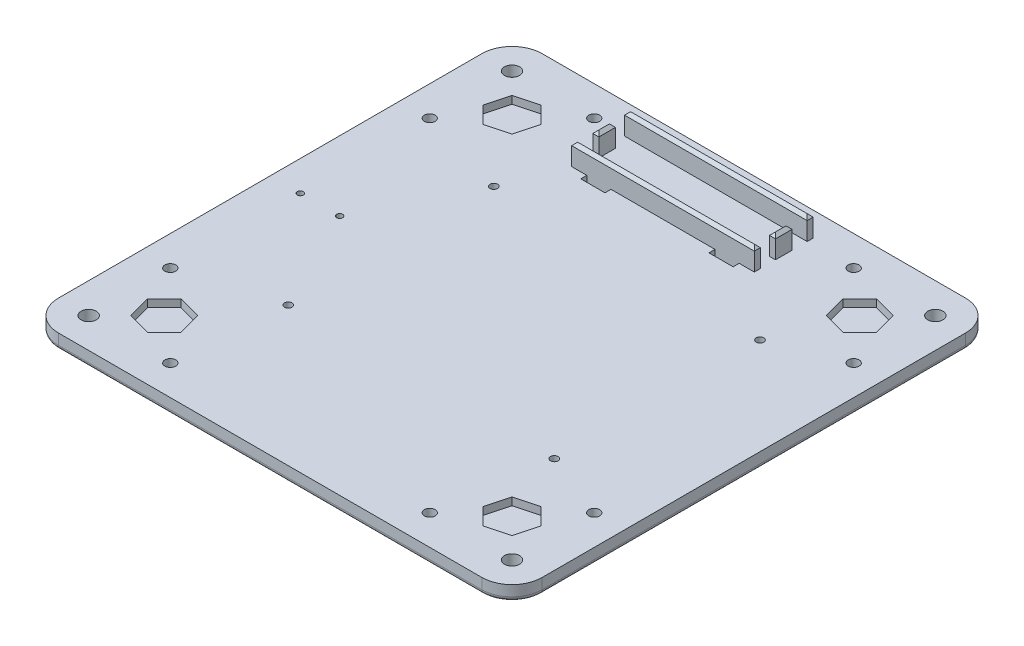
from build123d import *

# Parameters (mm, degrees)
SKETCH1_W           = 203.2
SKETCH1_H           = 203.2
BOSS_EXTRUDE1_DEPTH = 6.35
FILLET1_R           = 12.7
SKETCH2_R           = 3.175
CUT_EXTRUDE1_DEPTH  = 288.438345563
CUT_EXTRUDE2_DEPTH  = 3.175
FILLET2_R           = 1.905
SKETCH28_R          = 2.286
CUT_EXTRUDE3_DEPTH  = 288.438345634
SKETCH30_R          = 1.5875
CUT_EXTRUDE4_DEPTH  = 288.438345634
SKETCH31_R          = 1.27
CUT_EXTRUDE5_DEPTH  = 288.438345634
SKETCH32_W          = 2.54
SKETCH32_H          = 6.9596
BOSS_EXTRUDE3_DEPTH = 8.89
CHAMFER2_SIZE       = 1.27
SKETCH33_W          = 10.16
SKETCH33_H          = 2.54
CUT_EXTRUDE6_DEPTH  = 288.505673232


with BuildPart() as part:
    # Sketch1 → Boss-Extrude1 (new body)
    with BuildSketch(Plane(origin=(0, 0, 0), x_dir=(1, 0, 0), z_dir=(0, 1, 0))):
        with Locations((101.6, 101.6)):
            Rectangle(SKETCH1_W, SKETCH1_H)
    extrude(amount=BOSS_EXTRUDE1_DEPTH)

    # Fillet1
    fillet1_edges = [part.edges().sort_by_distance(p)[0] for p in [
        (0, 3.175, -203.2),
        (203.2, 3.175, -203.2),
        (203.2, 3.175, 0),
        (0, 3.175, 0),
    ]]
    fillet(fillet1_edges, radius=FILLET1_R)

    # Sketch2 → Cut-Extrude1 (cut, through all)
    with BuildSketch(Plane.XZ):
        with Locations(Location((12.7, -12.7, 0), (0, 0, 270))):
            Circle(SKETCH2_R)
        with Locations(Location((190.5, -12.7, 0), (0, 0, 270))):
            Circle(SKETCH2_R)
        with Locations(Location((190.5, -190.5, 0), (0, 0, 270))):
            Circle(SKETCH2_R)
        with Locations(Location((12.7, -190.5, 0), (0, 0, 270))):
            Circle(SKETCH2_R)
    extrude(amount=-CUT_EXTRUDE1_DEPTH, mode=Mode.SUBTRACT)

    # Sketch22 → Cut-Extrude2 (cut)
    with BuildSketch(Plane(origin=(0, 6.35, 0), x_dir=(1, 0, 0), z_dir=(0, 1, 0))):
        Polygon((181.654219065, 181.654219065), (172.052127253, 184.227091812), (165.022908188, 177.197872747), (167.595780935, 167.595780935), (177.197872747, 165.022908188), (184.227091812, 172.052127253), align=None)
        Polygon((18.972908188, 172.052127253), (21.545780935, 181.654219065), (31.147872747, 184.227091812), (38.177091812, 177.197872747), (35.604219065, 167.595780935), (26.002127253, 165.022908188), align=None)
        Polygon((184.227091812, 31.147872747), (181.654219065, 21.545780935), (172.052127253, 18.972908188), (165.022908188, 26.002127253), (167.595780935, 35.604219065), (177.197872747, 38.177091812), align=None)
        Polygon((21.545780935, 21.545780935), (31.147872747, 18.972908188), (38.177091812, 26.002127253), (35.604219065, 35.604219065), (26.002127253, 38.177091812), (18.972908188, 31.147872747), align=None)
    extrude(amount=-CUT_EXTRUDE2_DEPTH, mode=Mode.SUBTRACT)

    # Fillet2
    fillet2_edges = [part.edges().sort_by_distance(p)[0] for p in [
        (0, 0, -101.6),
        (101.6, 0, -203.2),
        (203.2, 0, -101.6),
        (101.6, 0, 0),
        (199.480256121, 0, -199.480256121),
        (199.480256121, 0, -3.719743879),
        (3.719743879, 0, -3.719743879),
        (3.719743879, 0, -199.480256121),
        (12.7, 0, -187.325),
        (190.5, 0, -187.325),
        (190.5, 0, -9.525),
        (12.7, 0, -9.525),
    ]]
    fillet(fillet2_edges, radius=FILLET2_R)

    # Sketch28 → Cut-Extrude3 (cut, through all)
    with BuildSketch(Plane(origin=(0, 6.35, 0), x_dir=(1, 0, 0), z_dir=(0, 1, 0))):
        with Locations(Location((47.117, 190.627, 0), (0, 0, 270))):
            Circle(SKETCH28_R)
        with Locations(Location((156.083, 190.627, 0), (0, 0, 270))):
            Circle(SKETCH28_R)
        with Locations(Location((190.627, 156.083, 0), (0, 0, 270))):
            Circle(SKETCH28_R)
        with Locations(Location((190.627, 47.117, 0), (0, 0, 270))):
            Circle(SKETCH28_R)
        with Locations(Location((156.083, 12.573, 0), (0, 0, 270))):
            Circle(SKETCH28_R)
        with Locations(Location((47.117, 12.573, 0), (0, 0, 270))):
            Circle(SKETCH28_R)
        with Locations(Location((12.573, 156.083, 0), (0, 0, 270))):
            Circle(SKETCH28_R)
        with Locations(Location((12.573, 47.117, 0), (0, 0, 270))):
            Circle(SKETCH28_R)
    extrude(amount=-CUT_EXTRUDE3_DEPTH, mode=Mode.SUBTRACT)

    # Sketch30 → Cut-Extrude4 (cut, through all)
    with BuildSketch(Plane(origin=(0, 6.35, 0), x_dir=(1, 0, 0), z_dir=(0, 1, 0))):
        with Locations(Location((50.8, 144.78, 0), (0, 0, 270))):
            Circle(SKETCH30_R)
        with Locations(Location((162.56, 144.78, 0), (0, 0, 270))):
            Circle(SKETCH30_R)
        with Locations(Location((162.56, 58.42, 0), (0, 0, 270))):
            Circle(SKETCH30_R)
        with Locations(Location((50.8, 58.42, 0), (0, 0, 270))):
            Circle(SKETCH30_R)
    extrude(amount=-CUT_EXTRUDE4_DEPTH, mode=Mode.SUBTRACT)

    # Sketch31 → Cut-Extrude5 (cut, through all)
    with BuildSketch(Plane(origin=(0, 6.35, 0), x_dir=(1, 0, 0), z_dir=(0, 1, 0))):
        with Locations(Location((12.7, 101.6, 0), (0, 0, 270))):
            Circle(SKETCH31_R)
        with Locations(Location((29.21, 101.6, 0), (0, 0, 270))):
            Circle(SKETCH31_R)
    extrude(amount=-CUT_EXTRUDE5_DEPTH, mode=Mode.SUBTRACT)

    # Sketch32 → Boss-Extrude3 (add)
    with BuildSketch(Plane(origin=(0, 6.35, 0), x_dir=(1, 0, 0), z_dir=(0, 1, 0))):
        Polygon((62.506860802, 190.5), (134.134860802, 190.5), (136.674860802, 190.5), (136.674860802, 193.04), (59.966860802, 193.04), (59.966860802, 190.5), align=None)
        with Locations((61.236860802, 180.6702)):
            Rectangle(SKETCH32_W, SKETCH32_H)
        Polygon((62.506860802, 170.8404), (134.134860802, 170.8404), (136.674860802, 170.8404), (136.674860802, 168.3004), (59.966860802, 168.3004), (59.966860802, 170.8404), align=None)
        with Locations((135.404860802, 180.6702)):
            Rectangle(SKETCH32_W, SKETCH32_H)
    extrude(amount=BOSS_EXTRUDE3_DEPTH)

    # Chamfer2
    chamfer2_edges = [part.edges().sort_by_distance(p)[0] for p in [
        (98.320860802, 15.24, -190.5),
        (136.674860802, 15.24, -191.77),
        (98.320860802, 15.24, -193.04),
        (59.966860802, 15.24, -191.77),
        (98.320860802, 15.24, -170.8404),
        (59.966860802, 15.24, -169.5704),
        (98.320860802, 15.24, -168.3004),
        (136.674860802, 15.24, -169.5704),
        (61.236860802, 15.24, -184.15),
        (59.966860802, 15.24, -180.6702),
        (61.236860802, 15.24, -177.1904),
        (62.506860802, 15.24, -180.6702),
        (136.674860802, 15.24, -180.6702),
        (135.404860802, 15.24, -184.15),
        (134.134860802, 15.24, -180.6702),
        (135.404860802, 15.24, -177.1904),
    ]]
    chamfer(chamfer2_edges, length=CHAMFER2_SIZE - 0.0001)  # a hair under: the kernel refuses the full size

    # Sketch33 → Cut-Extrude6 (cut, through all)
    with BuildSketch(Plane(origin=(0, 6.35, 0), x_dir=(1, 0, 0), z_dir=(0, 1, 0))):
        with Locations((71.396860802, 167.0304)):
            Rectangle(SKETCH33_W, SKETCH33_H)
        with Locations((125.244860802, 167.0304)):
            Rectangle(SKETCH33_W, SKETCH33_H)
        with Locations((125.244860802, 194.31)):
            Rectangle(SKETCH33_W, SKETCH33_H)
        with Locations((71.396860802, 194.31)):
            Rectangle(SKETCH33_W, SKETCH33_H)
    extrude(amount=-CUT_EXTRUDE6_DEPTH, mode=Mode.SUBTRACT)


solid = part.part
